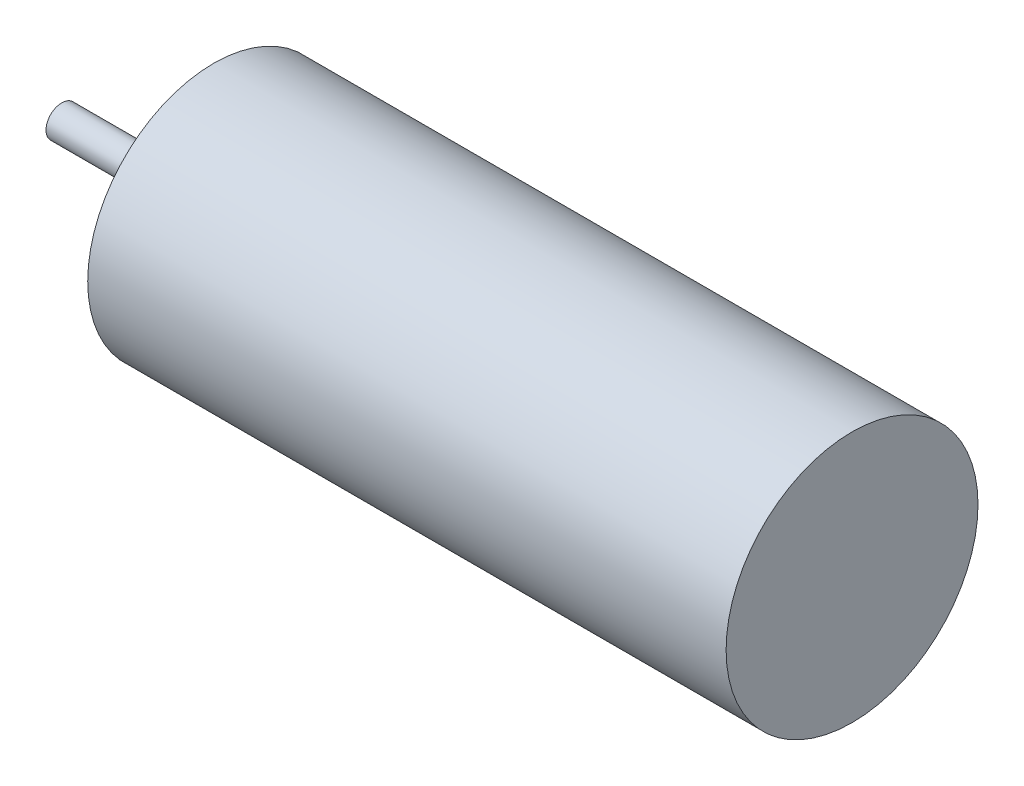
from build123d import *

# Parameters (mm, degrees)
SKETCH2_R          = 1.5
CUT_EXTRUDE1_DEPTH = 5


with BuildPart() as part:
    # Sketch1 → Revolve1 (revolve)
    with BuildSketch(Plane.XY):
        Polygon((0, 0), (100.4, 0), (100.4, 16), (19.3, 16), (19.3, 9), (15.5, 9), (15.5, 1.999996), (0, 1.999996), align=None)
    revolve(axis=Axis((0, 0, 0), (1, 0, 0)))

    # Sketch2 → Cut-Extrude1 (cut)
    with BuildSketch(Plane.ZY.offset(-19.3)):
        with Locations((0, 13)):
            Circle(SKETCH2_R)
        with Locations((0, -13)):
            Circle(SKETCH2_R)
        with Locations((-13, 0)):
            Circle(SKETCH2_R)
        with Locations((13, 0)):
            Circle(SKETCH2_R)
    extrude(amount=-CUT_EXTRUDE1_DEPTH, mode=Mode.SUBTRACT)


solid = part.part
